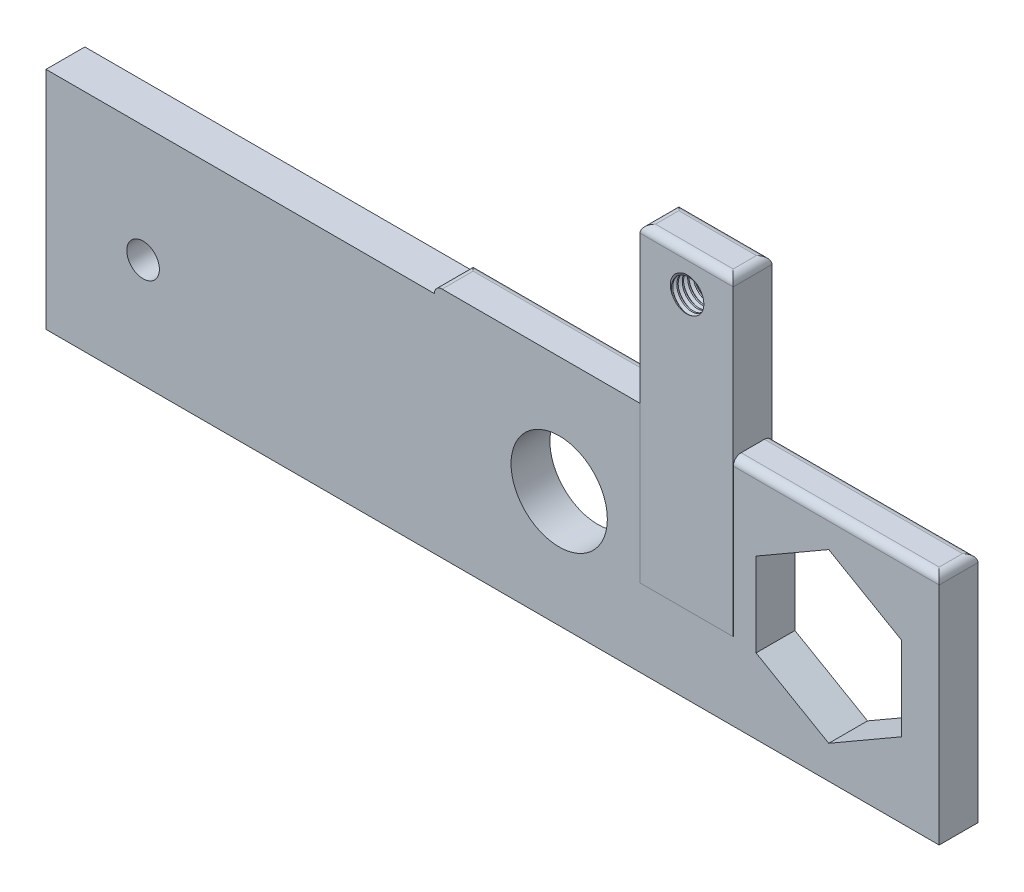
from build123d import *

# Parameters (mm, degrees)
SKETCH1_W           = 65
SKETCH1_H           = 30
BOSS_EXTRUDE1_DEPTH = 5
SKETCH2_R           = 6.2
CUT_EXTRUDE1_DEPTH  = 10
SKETCH4_W           = 12
SKETCH4_H           = 5
BOSS_EXTRUDE5_DEPTH = 20
SKETCH9_R           = 2
CUT_EXTRUDE3_DEPTH  = 30
THREAD1_PITCH       = 0.7
FILLET1_R           = 1
SKETCH10_W          = 5
SKETCH10_H          = 29
BOSS_EXTRUDE6_DEPTH = 50
SKETCH11_R          = 2.1
CUT_EXTRUDE4_DEPTH  = 50


with BuildPart() as part:
    # Sketch1 → Boss-Extrude1 (new body)
    with BuildSketch(Plane.XY):
        Rectangle(SKETCH1_W, SKETCH1_H)
    extrude(amount=BOSS_EXTRUDE1_DEPTH)

    # Sketch2 → Cut-Extrude1 (cut)
    with BuildSketch(Plane.XY.offset(5)):
        with Locations((-16.423651497, -0.024123926)):
            Circle(SKETCH2_R)
        Polygon((18.279422863, -10.760304849), (27.632497224, -5.360304849), (27.632497224, 5.439695151), (18.279422863, 10.839695151), (8.926348503, 5.439695151), (8.926348503, -5.360304849), align=None)
    extrude(amount=-CUT_EXTRUDE1_DEPTH, mode=Mode.SUBTRACT)

    # Sketch4 → Boss-Extrude5 (add, symmetric)
    with BuildSketch(Plane(origin=(0, 15, 0), x_dir=(1, 0, 0), z_dir=(0, 1, 0))):
        with Locations((0, -2.5242509)):
            Rectangle(SKETCH4_W, SKETCH4_H)
    extrude(amount=BOSS_EXTRUDE5_DEPTH, both=True)

    # Sketch9 → Cut-Extrude3 (cut, symmetric)
    with BuildSketch(Plane(origin=(0, 0, 0), x_dir=(-1, 0, 0), z_dir=(0, 0, -1))):
        with Locations((0, 30)):
            Circle(SKETCH9_R)
    extrude(amount=CUT_EXTRUDE3_DEPTH, both=True, mode=Mode.SUBTRACT)

    # Thread1: the profile of Thread Profile2 profile screwed along a right-hand helix of 14.285714 turns, 6 arcs to a turn; built about Z, then put on its axis
    thread1_z = Axis((0, 0, 0), (0, 0, 1))
    thread1_corners = [(1.9997, 0, -0.000173205), (2.378886113, 0, 0.218749999), (2.378886113, 0, 0.306249999), (1.9997, 0, 0.525173203)]
    with BuildLine(mode=Mode.PRIVATE) as thread1_profile:
        Line(thread1_corners[0], thread1_corners[1])
        Line(thread1_corners[1], thread1_corners[2])
        Line(thread1_corners[2], thread1_corners[3])
        Line(thread1_corners[3], thread1_corners[0])
    thread1_cap = Face(thread1_profile.wire())
    thread1_turn_angles = [0, 30, 60, 90, 120, 150, 180, 210, 240, 270, 300, 330, 360]
    thread1_turn_weights = [1, 0.8660254037844387, 1, 0.8660254037844387, 1, 0.8660254037844387, 1, 0.8660254037844387, 1, 0.8660254037844387, 1, 0.8660254037844387, 1]
    thread1_turn_rails = [Edge.make_bspline([Vector(p[0], p[1], 0).rotate(thread1_z, thread1_turn_angles[k]) / thread1_turn_weights[k] + Vector(0, 0, p[2] + THREAD1_PITCH * thread1_turn_angles[k] / 360) for k in range(13)], [0, 0, 0, 1, 1, 2, 2, 3, 3, 4, 4, 5, 5, 6, 6, 6], 2, thread1_turn_weights) for p in thread1_corners]
    thread1_turn_sides = [Face.make_surface_from_curves(thread1_turn_rails[p[0]], thread1_turn_rails[p[1]]) for p in [(0, 1), (1, 2), (2, 3), (3, 0)]]
    thread1_last_angles = [5040, 5070, 5100, 5121.428571429, 5142.857142857]
    thread1_last_weights = [1, 0.8660254037844387, 1, 0.9308737486442035, 1]
    thread1_last_rails = [Edge.make_bspline([Vector(p[0], p[1], 0).rotate(thread1_z, thread1_last_angles[k]) / thread1_last_weights[k] + Vector(0, 0, p[2] + THREAD1_PITCH * thread1_last_angles[k] / 360) for k in range(5)], [0, 0, 0, 1, 1, 2, 2, 2], 2, thread1_last_weights) for p in thread1_corners]
    thread1_last_sides = [Face.make_surface_from_curves(thread1_last_rails[p[0]], thread1_last_rails[p[1]]) for p in [(0, 1), (1, 2), (2, 3), (3, 0)]]
    thread1 = Plane(origin=(0, 30, -0.9757491), x_dir=(1, 0, 0), z_dir=(0, 0, 1)) * Solid(Shell([*[p.moved(Location((0, 0, THREAD1_PITCH * i))) for i in range(14) for p in thread1_turn_sides], *thread1_last_sides, thread1_cap, thread1_cap.rotate(thread1_z, 5142.857142857).moved(Location((0, 0, THREAD1_PITCH * 5142.857142857 / 360)))]))
    add(thread1, mode=Mode.SUBTRACT)

    # Fillet1
    # the kernel refuses this fillet: 1 mm, written as the material it takes off along each edge
    with BuildSketch(Plane(origin=(6, 35, -2.4757491), x_dir=(0, -1, 0), z_dir=(0, 0, 1)), Plane(origin=(-6, 35, 7.5242509), x_dir=(0, -1, 0), z_dir=(0, 0, -1)), Plane(origin=(-32.5, 15, -2.5), x_dir=(1, 0, 0), z_dir=(0, 0, 1))) as fillet1_piece_1:
        with BuildLine():
            CenterArc((FILLET1_R, -FILLET1_R), FILLET1_R, 90, 90)
            Line((0, -FILLET1_R), (0, 0))
            Line((0, 0), (FILLET1_R, 0))
        make_face()
    fillet1_piece_1_solid = extrude(amount=10, mode=Mode.PRIVATE)
    with BuildSketch(Plane(origin=(-8.5, 35, 0.0242509), x_dir=(0, -1, 0), z_dir=(1, 0, 0))) as fillet1_piece_2:
        with BuildLine():
            CenterArc((FILLET1_R, -FILLET1_R), FILLET1_R, 90, 90)
            Line((0, -FILLET1_R), (0, 0))
            Line((0, 0), (FILLET1_R, 0))
        make_face()
    fillet1_piece_2_solid = extrude(amount=17, mode=Mode.PRIVATE)
    with BuildSketch(Plane(origin=(8.5, 35, 5.0242509), x_dir=(0, 0, -1), z_dir=(-1, 0, 0))) as fillet1_piece_3:
        with BuildLine():
            CenterArc((FILLET1_R, FILLET1_R), FILLET1_R, 180, 90)
            Line((0, FILLET1_R), (0, 0))
            Line((0, 0), (FILLET1_R, 0))
        make_face()
    fillet1_piece_3_solid = extrude(amount=17, mode=Mode.PRIVATE)
    with BuildSketch(Plane(origin=(-35, 15, 0), x_dir=(0, 0, 1), z_dir=(1, 0, 0))) as fillet1_piece_4_section:
        with BuildLine():
            CenterArc((FILLET1_R, FILLET1_R), FILLET1_R, 180, 90)
            Line((0, FILLET1_R), (0, 0))
            Line((0, 0), (FILLET1_R, 0))
        make_face()
    fillet1_piece_4 = extrude(amount=70, mode=Mode.PRIVATE)
    fillet1_piece_4 = split(fillet1_piece_4, bisect_by=Plane(origin=(-20.5, 14.817863183, 0.0242509), z_dir=(0, 0, 1)), keep=Keep.TOP, mode=Mode.PRIVATE)
    fillet1_piece_4 = split(fillet1_piece_4, bisect_by=Plane(origin=(-6, 14.817863183, 0.270305417), z_dir=(-1, 0, 0)), keep=Keep.TOP, mode=Mode.PRIVATE)
    with BuildSketch(Plane(origin=(-35, 15, 0), x_dir=(0, 0, 1), z_dir=(1, 0, 0))) as fillet1_piece_5_section:
        with BuildLine():
            CenterArc((FILLET1_R, FILLET1_R), FILLET1_R, 180, 90)
            Line((0, FILLET1_R), (0, 0))
            Line((0, 0), (FILLET1_R, 0))
        make_face()
    fillet1_piece_5 = extrude(amount=70, mode=Mode.PRIVATE)
    fillet1_piece_5 = split(fillet1_piece_5, bisect_by=Plane(origin=(-20.5, 14.546490451, 0.0242509), z_dir=(0, 0, -1)), keep=Keep.TOP, mode=Mode.PRIVATE)
    fillet1_piece_5 = split(fillet1_piece_5, bisect_by=Plane(origin=(-6, 14.546490451, 0.001066435), z_dir=(-1, 0, 0)), keep=Keep.TOP, mode=Mode.PRIVATE)
    with BuildSketch(Plane(origin=(-35, 15, 0), x_dir=(0, 0, 1), z_dir=(1, 0, 0))) as fillet1_piece_6_section:
        with BuildLine():
            CenterArc((FILLET1_R, FILLET1_R), FILLET1_R, 180, 90)
            Line((0, FILLET1_R), (0, 0))
            Line((0, 0), (FILLET1_R, 0))
        make_face()
    fillet1_piece_6 = extrude(amount=70, mode=Mode.PRIVATE)
    fillet1_piece_6 = split(fillet1_piece_6, bisect_by=Plane(origin=(6, 14.546490451, 0.001066435), z_dir=(-1, 0, 0)), keep=Keep.TOP, mode=Mode.PRIVATE)
    fillet1_piece_6 = split(fillet1_piece_6, bisect_by=Plane(origin=(0, 14.546490451, 0.0242509), z_dir=(0, 0, -1)), keep=Keep.TOP, mode=Mode.PRIVATE)
    fillet1_piece_6 = split(fillet1_piece_6, bisect_by=Plane(origin=(-6, 14.546490451, 0.001066435), z_dir=(1, 0, 0)), keep=Keep.TOP, mode=Mode.PRIVATE)
    with BuildSketch(Plane(origin=(-35, 15, 0), x_dir=(0, 0, 1), z_dir=(1, 0, 0))) as fillet1_piece_7_section:
        with BuildLine():
            CenterArc((FILLET1_R, FILLET1_R), FILLET1_R, 180, 90)
            Line((0, FILLET1_R), (0, 0))
            Line((0, 0), (FILLET1_R, 0))
        make_face()
    fillet1_piece_7 = extrude(amount=70, mode=Mode.PRIVATE)
    fillet1_piece_7 = split(fillet1_piece_7, bisect_by=Plane(origin=(6, 14.817863183, 0.270305417), z_dir=(1, 0, 0)), keep=Keep.TOP, mode=Mode.PRIVATE)
    fillet1_piece_7 = split(fillet1_piece_7, bisect_by=Plane(origin=(20.5, 14.817863183, 0.0242509), z_dir=(0, 0, 1)), keep=Keep.TOP, mode=Mode.PRIVATE)
    with BuildSketch(Plane(origin=(-35, 15, 0), x_dir=(0, 0, 1), z_dir=(1, 0, 0))) as fillet1_piece_8_section:
        with BuildLine():
            CenterArc((FILLET1_R, FILLET1_R), FILLET1_R, 180, 90)
            Line((0, FILLET1_R), (0, 0))
            Line((0, 0), (FILLET1_R, 0))
        make_face()
    fillet1_piece_8 = extrude(amount=70, mode=Mode.PRIVATE)
    fillet1_piece_8 = split(fillet1_piece_8, bisect_by=Plane(origin=(6, 14.546490451, 0.001066435), z_dir=(1, 0, 0)), keep=Keep.TOP, mode=Mode.PRIVATE)
    fillet1_piece_8 = split(fillet1_piece_8, bisect_by=Plane(origin=(20.5, 14.546490451, 0.0242509), z_dir=(0, 0, -1)), keep=Keep.TOP, mode=Mode.PRIVATE)
    with BuildSketch(Plane(origin=(32.5, 15, -2.5), x_dir=(-1, 0, 0), z_dir=(0, 0, 1))) as fillet1_piece_9:
        with BuildLine():
            CenterArc((FILLET1_R, FILLET1_R), FILLET1_R, 180, 90)
            Line((0, FILLET1_R), (0, 0))
            Line((0, 0), (FILLET1_R, 0))
        make_face()
    fillet1_piece_9_solid = extrude(amount=10, mode=Mode.PRIVATE)
    with BuildSketch(Plane(origin=(6, 15, 5), x_dir=(0, 0, -1), z_dir=(1, 0, 0))) as fillet1_piece_10:
        with BuildLine():
            CenterArc((FILLET1_R, -FILLET1_R), FILLET1_R, 90, 90)
            Line((0, -FILLET1_R), (0, 0))
            Line((0, 0), (FILLET1_R, 0))
        make_face()
    fillet1_piece_10_solid = extrude(amount=29, mode=Mode.PRIVATE)
    add([fillet1_piece_1_solid, fillet1_piece_2_solid, fillet1_piece_3_solid, fillet1_piece_4, fillet1_piece_5, fillet1_piece_6, fillet1_piece_7, fillet1_piece_8, fillet1_piece_9_solid, fillet1_piece_10_solid], mode=Mode.SUBTRACT)

    # Sketch10 → Boss-Extrude6 (add)
    with BuildSketch(Plane.ZY.offset(32.5)):
        with Locations((2.5, -0.5)):
            Rectangle(SKETCH10_W, SKETCH10_H)
    extrude(amount=BOSS_EXTRUDE6_DEPTH)

    # Sketch11 → Cut-Extrude4 (cut)
    with BuildSketch(Plane.XY.offset(5)):
        with Locations((-70, -1)):
            Circle(SKETCH11_R)
    extrude(amount=-CUT_EXTRUDE4_DEPTH, mode=Mode.SUBTRACT)


solid = part.part
